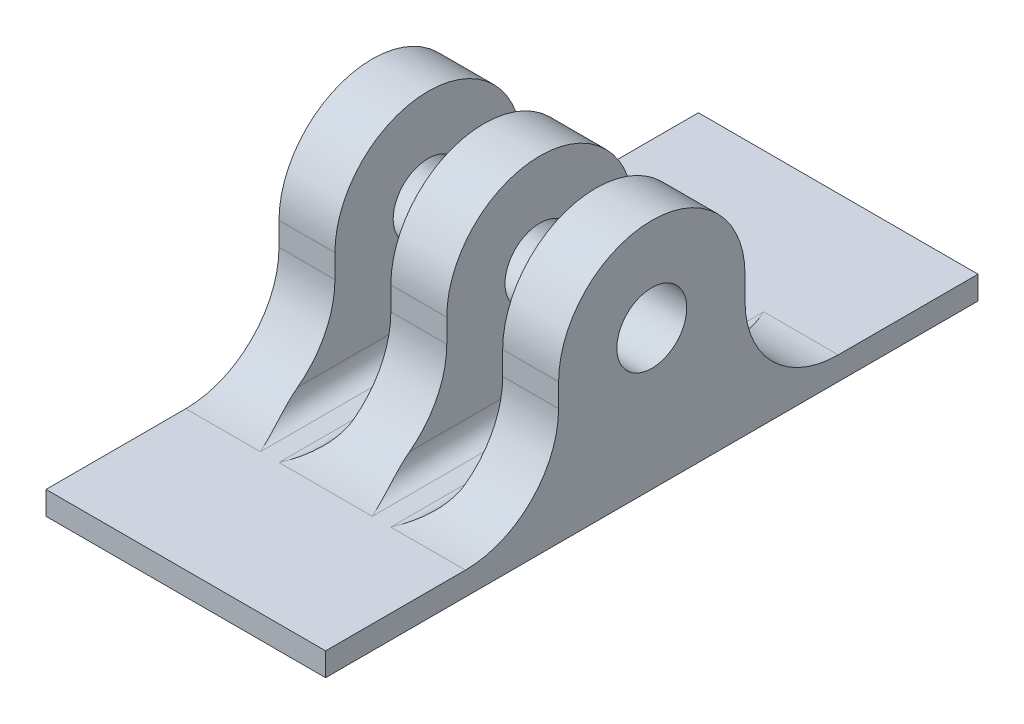
from build123d import *

# Parameters (mm, degrees)
SKETCH1_R           = 4.762500000000008
BOSS_EXTRUDE1_DEPTH = 38.1
SKETCH3_W           = 3.1750000000000043
SKETCH3_H           = 31.750000000000004
CUT_EXTRUDE1_DEPTH  = 12.7
SKETCH4_W           = 7.62
SKETCH4_H           = 6.350000000000001
SKETCH4_W_2         = 7.619999999999997
CUT_EXTRUDE2_DEPTH  = 60.05841387981902
SKETCH6_W           = 31.749999999999986
SKETCH6_H           = 31.750000000000004
CUT_EXTRUDE3_DEPTH  = 12.7
SKETCH7_W           = 38.1
SKETCH7_H           = 88.89999999999999
BOSS_EXTRUDE2_DEPTH = 3.175
FILLET1_R           = 2.54
FILLET2_R           = 12.7


with BuildPart() as part:
    # Sketch1 → Boss-Extrude1 (new body)
    # profile 1 of 3: a face of its own
    with BuildSketch(Plane(origin=(0, 0, 0), x_dir=(0, 0, -1), z_dir=(1, 0, 0))):
        Polygon((0, 0), (31.75, 3.89e-15), (31.749999999999993, 12.700000000000003), (0, 12.7), align=None)
    # profile 2 of 3: a face of its own
    with BuildSketch(Plane(origin=(0, 0, 0), x_dir=(0, 0, -1), z_dir=(1, 0, 0))):
        Polygon((28.575000000000003, 15.875000000000004), (3.1749999999999963, 15.875), (-3.1750000000000034, 15.875), (-3.1750000000000034, 12.7), (0, 12.7), (31.749999999999993, 12.700000000000003), (34.925, 12.700000000000005), (34.925, 15.875000000000004), align=None)
    # profile 3 of 3: a face of its own
    with BuildSketch(Plane(origin=(0, 0, 0), x_dir=(0, 0, -1), z_dir=(1, 0, 0))):
        with BuildLine():
            ThreePointArc((28.574999999999996, 31.75), (15.874999999999991, 44.45), (3.17499999999999, 31.749999999999996))
            Line((3.1749999999999936, 31.75), (3.174999999999996, 15.875))
            Line((3.1749999999999963, 15.875), (28.575000000000003, 15.875000000000004))
            Line((28.575, 15.875000000000004), (28.574999999999996, 31.75))
        make_face()
        with Locations(Location((15.874999999999996, 31.75, 0), (0, 0, 180))):
            Circle(SKETCH1_R, mode=Mode.SUBTRACT)
    extrude(amount=BOSS_EXTRUDE1_DEPTH)

    # Sketch3 → Cut-Extrude1 (cut)
    with BuildSketch(Plane.XZ):
        with Locations((1.5875000000000021, -15.875000000000002)):
            Rectangle(SKETCH3_W, SKETCH3_H)
        Polygon((34.92499999999999, 0), (34.92499999999999, -31.749999999999993), (38.1, -31.75), (38.1, 0), align=None)
    extrude(amount=-CUT_EXTRUDE1_DEPTH, mode=Mode.SUBTRACT)

    # Sketch4 → Cut-Extrude2 (cut, through all)
    with BuildSketch(Plane(origin=(0, 15.875, 1.45e-15), x_dir=(1, 0, 0), z_dir=(0, 1, 9e-17))):
        Polygon((15.240000000000002, 28.574999999999996), (7.620000000000001, 28.574999999999996), (7.620000000000005, -3.1750000000000043), (15.240000000000007, -3.175000000000002), align=None)
        Polygon((30.48, 28.574999999999996), (22.860000000000003, 28.574999999999996), (22.860000000000007, -3.1750000000000043), (30.480000000000008, -3.175000000000002), align=None)
        with Locations((11.43, 31.749999999999996)):
            Rectangle(SKETCH4_W, SKETCH4_H)
        with Locations((26.67, 31.749999999999996)):
            Rectangle(SKETCH4_W_2, SKETCH4_H)
    extrude(amount=CUT_EXTRUDE2_DEPTH, mode=Mode.SUBTRACT)

    # Sketch6 → Cut-Extrude3 (cut)
    with BuildSketch(Plane.XZ):
        with Locations((19.049999999999997, -15.875000000000002)):
            Rectangle(SKETCH6_W, SKETCH6_H)
    extrude(amount=-CUT_EXTRUDE3_DEPTH, mode=Mode.SUBTRACT)

    # Sketch7 → Boss-Extrude2 (add)
    with BuildSketch(Plane.XZ.offset(-12.7)):
        with Locations((19.05, -15.875)):
            Rectangle(SKETCH7_W, SKETCH7_H)
    extrude(amount=-BOSS_EXTRUDE2_DEPTH)

    # Fillet1
    fillet1_edges = [part.edges().sort_by_distance(p)[0] for p in [
        (30.480000000000004, 15.875000000000002, -15.875),
        (22.860000000000003, 15.875000000000002, -15.875),
        (15.240000000000004, 15.875000000000002, -15.875),
        (7.620000000000003, 15.875000000000002, -15.875),
    ]]
    fillet(fillet1_edges, radius=FILLET1_R)

    # Fillet2
    fillet2_edges = [part.edges().sort_by_distance(p)[0] for p in [
        (33.02, 15.875, -3.1749999999999963),
    ]]
    fillet(fillet2_edges, radius=FILLET2_R)
    fillet2_2_edges = [part.edges().sort_by_distance(p)[0] for p in [
        (5.080000000000002, 15.875, -3.1749999999999963),
    ]]
    fillet(fillet2_2_edges, radius=FILLET2_R)
    fillet2_3_edges = [part.edges().sort_by_distance(p)[0] for p in [
        (5.08, 15.875000000000004, -28.575000000000003),
    ]]
    fillet(fillet2_3_edges, radius=FILLET2_R)
    fillet2_4_edges = [part.edges().sort_by_distance(p)[0] for p in [
        (33.02, 15.875000000000004, -28.575000000000003),
    ]]
    fillet(fillet2_4_edges, radius=FILLET2_R)
    fillet2_5_edges = [part.edges().sort_by_distance(p)[0] for p in [
        (19.050000000000008, 15.875, -3.174999999999996),
    ]]
    fillet(fillet2_5_edges, radius=FILLET2_R)
    fillet2_6_edges = [part.edges().sort_by_distance(p)[0] for p in [
        (19.050000000000004, 15.875000000000002, -28.575),
    ]]
    fillet(fillet2_6_edges, radius=FILLET2_R)


solid = part.part
